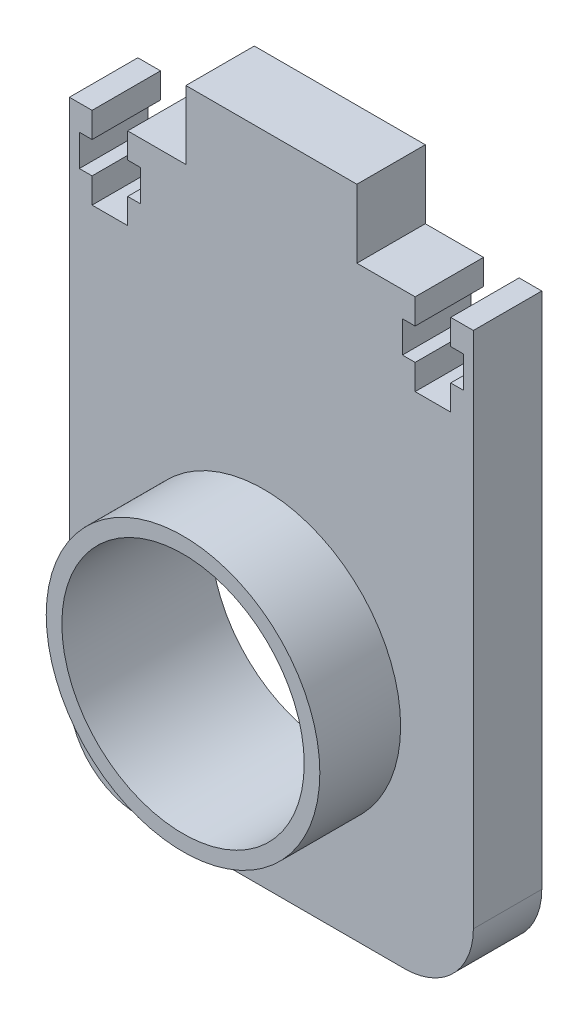
from build123d import *

# Parameters (mm, degrees)
SKETCH12_W           = 75
SKETCH12_H           = 121.71
BOSS_EXTRUDE10_DEPTH = 12.7
SKETCH15_R           = 25.4
BOSS_EXTRUDE11_DEPTH = 15
SKETCH23_R           = 22.5
CUT_EXTRUDE7_DEPTH   = 186.429535576
FILLET2_R            = 12.8
SKETCH25_W           = 21.625
SKETCH25_H           = 12.7
CUT_EXTRUDE9_DEPTH   = 184.961470596
CUT_EXTRUDE10_DEPTH  = 184.961470596


with BuildPart() as part:
    # Sketch12 → Boss-Extrude10 (new body)
    with BuildSketch(Plane.XY):
        with Locations((99.625849364, 60.855)):
            Rectangle(SKETCH12_W, SKETCH12_H)
    extrude(amount=BOSS_EXTRUDE10_DEPTH)

    # Sketch15 → Boss-Extrude11 (add)
    with BuildSketch(Plane.XY.offset(12.7)):
        with Locations((98.219620603, 38.627603634)):
            Circle(SKETCH15_R)
    extrude(amount=BOSS_EXTRUDE11_DEPTH)

    # Sketch23 → Cut-Extrude7 (cut, through all)
    with BuildSketch(Plane.XY.offset(27.7)):
        with Locations((98.219620603, 38.627603634)):
            Circle(SKETCH23_R)
    extrude(amount=-CUT_EXTRUDE7_DEPTH, mode=Mode.SUBTRACT)

    # Fillet2
    fillet2_edges = [part.edges().sort_by_distance(p)[0] for p in [
        (137.125849364, 0, 6.35),
        (62.125849364, 0, 6.35),
    ]]
    fillet(fillet2_edges, radius=FILLET2_R)

    # Sketch25 → Cut-Extrude9 (cut, through all)
    with BuildSketch(Plane.XY.offset(12.7)):
        with Locations((126.313349364, 115.36)):
            Rectangle(SKETCH25_W, SKETCH25_H)
        with Locations((72.938349364, 115.36)):
            Rectangle(SKETCH25_W, SKETCH25_H)
    extrude(amount=-CUT_EXTRUDE9_DEPTH, mode=Mode.SUBTRACT)

    # Sketch27 → Cut-Extrude10 (cut, through all)
    with BuildSketch(Plane.XY.offset(12.7)):
        Polygon((132.917349364, 109.01), (132.917349364, 104.311), (135.279349364, 104.311), (135.279349364, 98.469), (132.917349364, 98.469), (132.917349364, 93.77), (126.313349364, 93.77), (126.313349364, 98.469), (123.951349364, 98.469), (123.951349364, 104.311), (126.313349364, 104.311), (126.313349364, 109.01), align=None)
        Polygon((72.938349364, 98.469), (75.300349364, 98.469), (75.300349364, 104.311), (72.938349364, 104.311), (72.938349364, 109.01), (66.334349364, 109.01), (66.334349364, 104.311), (63.972349364, 104.311), (63.972349364, 98.469), (66.334349364, 98.469), (66.334349364, 93.77), (72.938349364, 93.77), align=None)
    extrude(amount=-CUT_EXTRUDE10_DEPTH, mode=Mode.SUBTRACT)


solid = part.part
